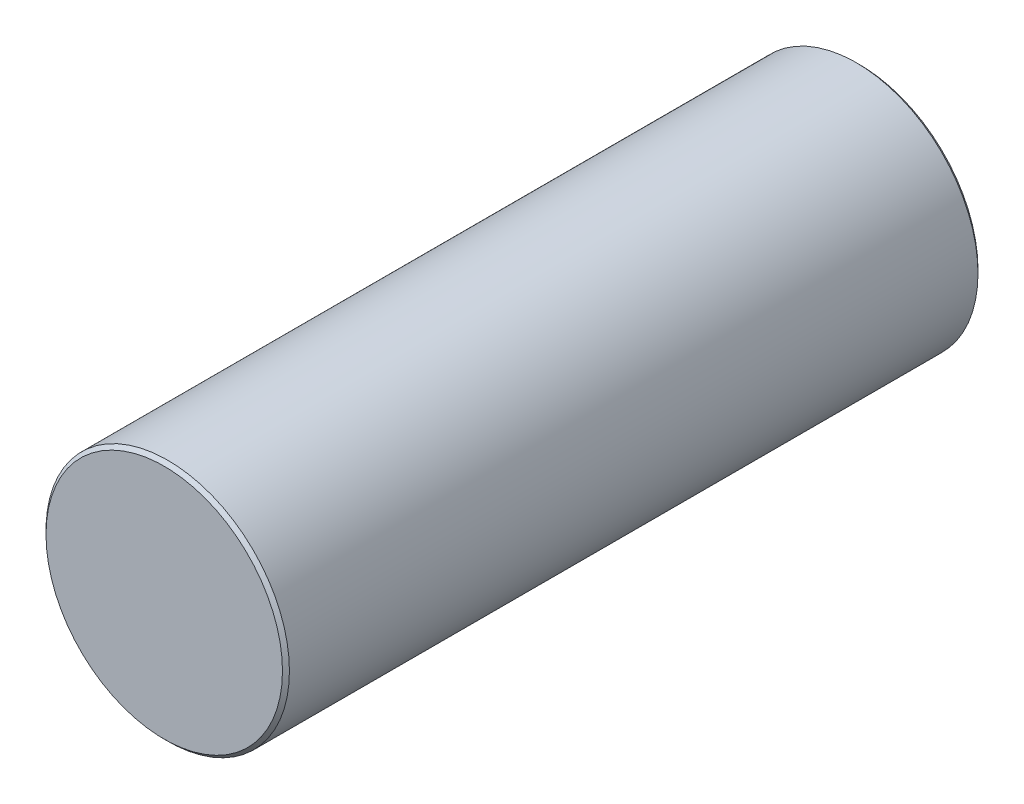
from build123d import *

# Parameters (mm, degrees)
SKETCH2_R           = 1.75
BOSS_EXTRUDE1_DEPTH = 10
CHAMFER2_SIZE       = 0.05


with BuildPart() as part:
    # Sketch2 → Boss-Extrude1 (new body)
    with BuildSketch(Plane.XY):
        Circle(SKETCH2_R)
    extrude(amount=BOSS_EXTRUDE1_DEPTH)

    # Chamfer2
    chamfer2_edges = [part.edges().sort_by_distance(p)[0] for p in [
        (-1.75, 0, 10),
        (-1.75, 0, 0),
    ]]
    chamfer(chamfer2_edges, length=CHAMFER2_SIZE)


solid = part.part
